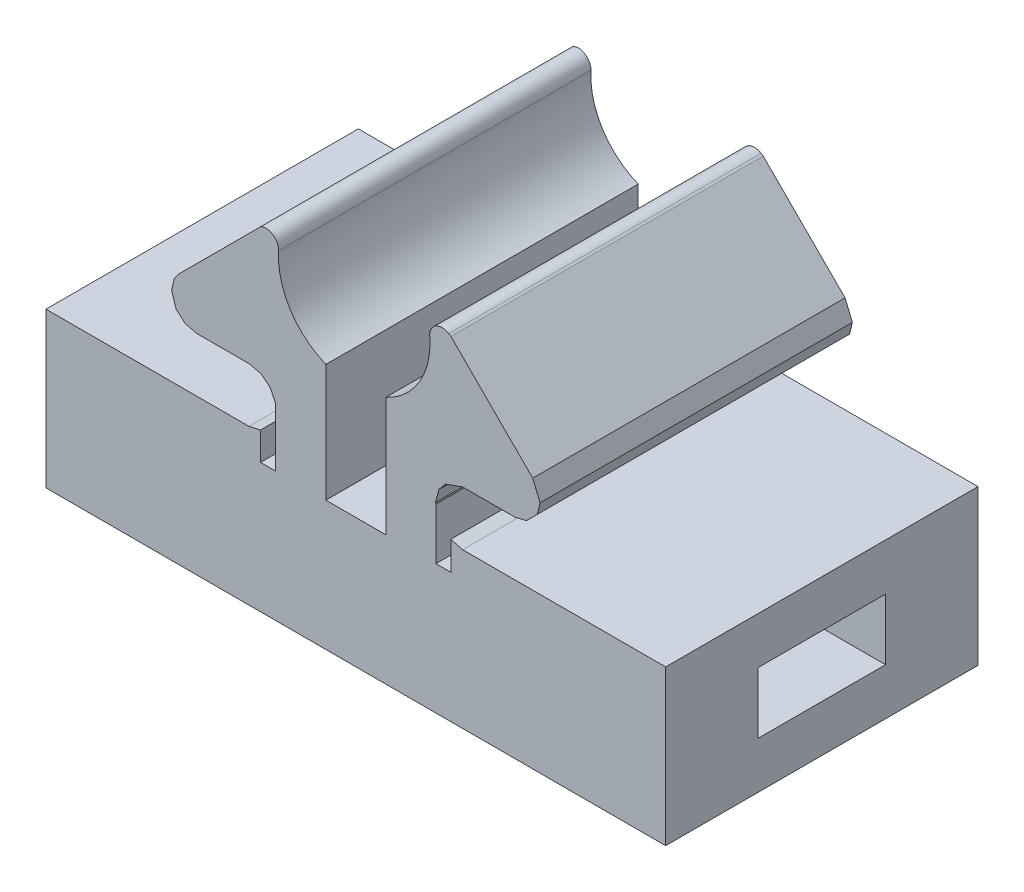
from build123d import *

# Parameters (mm, degrees)
BOSS_EXTRUDE1_DEPTH     = 12.7
SKETCH10_R              = 3.082136138
CUT_EXTRUDE1_DEPTH      = 26.185474767
SKETCH11_W              = 2.435876878
SKETCH11_H              = 7.908405343
CUT_EXTRUDE2_DEPTH      = 26.185474767
CUT_EXTRUDE4_DEPTH      = 31.460304214
CUT_EXTRUDE4_DEPTH_BACK = 31.460304214
SKETCH13_W              = 5.182015338
SKETCH13_H              = 2.489456313
FILLET3_R               = 0.508
SKETCH17_W              = 0.605016918
SKETCH17_H              = 2.095446093
SKETCH17_W_2            = 0.604461085
SKETCH17_H_2            = 2.141007526
CUT_EXTRUDE7_DEPTH      = 26.185474767
SKETCH19_W              = 12.7
SKETCH19_H              = 6.295576116
BOSS_EXTRUDE2_DEPTH     = 3.048
SKETCH20_W              = 12.7
SKETCH20_H              = 6.295576116
BOSS_EXTRUDE3_DEPTH     = 2.0066
SKETCH22_W              = 5.182015338
SKETCH22_H              = 2.489456313
CUT_EXTRUDE8_DEPTH      = 35.014712144


with BuildPart() as part:
    # Sketch5 → Boss-Extrude1 (new body)
    with BuildSketch(Plane.XY):
        Polygon((-6.474794456, -10.4902), (-6.938297275, -10.378313453), (-7.308763147, -10.05450356), (-7.490794456, -9.4742), (-7.378907909, -9.01069718), (-7.193214945, -8.75577951), (-3.863171405, -5.42573597), (-2.833127272, -4.737482484), (-1.618107374, -4.4958), (1.618107374, -4.4958), (2.668236067, -4.674493152), (3.863171405, -5.42573597), (7.193214945, -8.75577951), (7.490794456, -9.4742), (7.378907909, -9.93770282), (6.938297275, -10.378313453), (6.474794456, -10.4902), (4.3434, -10.4902), (3.646537163, -10.737670005), (3.377082754, -11.059343535), (3.2385, -11.5951), (3.485970005, -12.291962837), (3.807643535, -12.561417246), (4.3434, -12.7), (10.5918, -12.7), (10.5918, -18.995576116), (-9.5504, -18.995576116), (-9.5504, -12.7), (-4.3434, -12.7), (-3.863171405, -12.590180165), (-3.485969976, -12.291962837), (-3.271081829, -11.861441531), (-3.271081829, -11.328758469), (-3.485969976, -10.898237163), (-3.863171405, -10.600019835), (-4.3434, -10.4902), align=None)
    extrude(amount=-BOSS_EXTRUDE1_DEPTH)

    # Sketch10 → Cut-Extrude1 (cut, through all)
    with BuildSketch(Plane.XY):
        with Locations((-0.066530556, -6.095976424)):
            Circle(SKETCH10_R)
    extrude(amount=-CUT_EXTRUDE1_DEPTH, mode=Mode.SUBTRACT)

    # Sketch11 → Cut-Extrude2 (cut, through all)
    with BuildSketch(Plane.XY):
        with Locations((0, -9.781904855)):
            Rectangle(SKETCH11_W, SKETCH11_H)
    extrude(amount=-CUT_EXTRUDE2_DEPTH, mode=Mode.SUBTRACT)

    # Sketch13 → Cut-Extrude4 (cut, two sides: drawn at the far end of the back side and taken through both)
    with BuildSketch(Plane.ZY.offset(9.5504).offset(-CUT_EXTRUDE4_DEPTH_BACK)):
        with Locations((-6.35, -15.847788058)):
            Rectangle(SKETCH13_W, SKETCH13_H)
    extrude(amount=CUT_EXTRUDE4_DEPTH + CUT_EXTRUDE4_DEPTH_BACK, mode=Mode.SUBTRACT)

    # Fillet3
    # the kernel refuses this fillet: 0.508 mm, written as the material it takes off along each edge
    with BuildSketch(Plane(origin=(2.668236067, -4.674493152, 3.28944818), x_dir=(0.8465916632907231, -0.5322429479538896, 0), z_dir=(0, 0, -1))) as fillet3_piece_1:
        with BuildLine():
            CenterArc((1.315779272, 0.508), FILLET3_R, 143.192029884, 126.807970116)
            Line((0.90905007, 0.812360569), (0.900915486, 0.81844778))
            ThreePointArc((0.900915486, 0.81844778), (0.488321858, 0.368360866), (-0.005137978, 0.008765089))
            Line((-0.005137978, 0.008765089), (0, -0.01016))
            Line((0, -0.01016), (1.315779272, -0.01016))
            Line((1.315779272, -0.01016), (1.315779272, 0))
        make_face()
    extrude(amount=19.278896361, mode=Mode.SUBTRACT)
    with BuildSketch(Plane(origin=(-2.833127272, -4.737482484, 3.097058862), x_dir=(-0.2544986167721869, -0.9670731379068719, 0), z_dir=(0, 0, -1))) as fillet3_piece_2:
        with BuildLine():
            CenterArc((1.319821852, 0.497962426), FILLET3_R, 140.517787887, 118.073467257)
            Line((0.927736265, 0.820968451), (0.919894553, 0.827428572))
            ThreePointArc((0.919894553, 0.827428572), (0.4571351, 0.418092896), (-0.006733033, 0.007608671))
            Line((-0.006733033, 0.007608671), (0.002009719, -0.009959249))
            ThreePointArc((0.002009719, -0.009959249), (0.60966796, 0.050739942), (1.217326201, -0.009959249))
            Line((1.217326201, -0.009959249), (1.219335919, 0))
        make_face()
    extrude(amount=18.894117724, mode=Mode.SUBTRACT)

    # Sketch17 → Cut-Extrude7 (cut, through all)
    with BuildSketch(Plane.XY):
        with Locations((3.55718824, -12.68838448)):
            Rectangle(SKETCH17_W, SKETCH17_H)
        with Locations((-3.573312372, -12.665603763)):
            Rectangle(SKETCH17_W_2, SKETCH17_H_2)
    extrude(amount=-CUT_EXTRUDE7_DEPTH, mode=Mode.SUBTRACT)

    # Sketch19 → Boss-Extrude2 (add)
    with BuildSketch(Plane.ZY.offset(9.5504)):
        with Locations((-6.35, -15.847788058)):
            Rectangle(SKETCH19_W, SKETCH19_H)
    extrude(amount=BOSS_EXTRUDE2_DEPTH)

    # Sketch20 → Boss-Extrude3 (add)
    with BuildSketch(Plane(origin=(10.5918, 0, 0), x_dir=(0, 0, -1), z_dir=(1, 0, 0))):
        with Locations((6.35, -15.847788058)):
            Rectangle(SKETCH20_W, SKETCH20_H)
    extrude(amount=BOSS_EXTRUDE3_DEPTH)

    # Sketch22 → Cut-Extrude8 (cut, through all)
    with BuildSketch(Plane.ZY.offset(12.5984)):
        with Locations((-6.35, -15.847788058)):
            Rectangle(SKETCH22_W, SKETCH22_H)
    extrude(amount=-CUT_EXTRUDE8_DEPTH, mode=Mode.SUBTRACT)


solid = part.part
